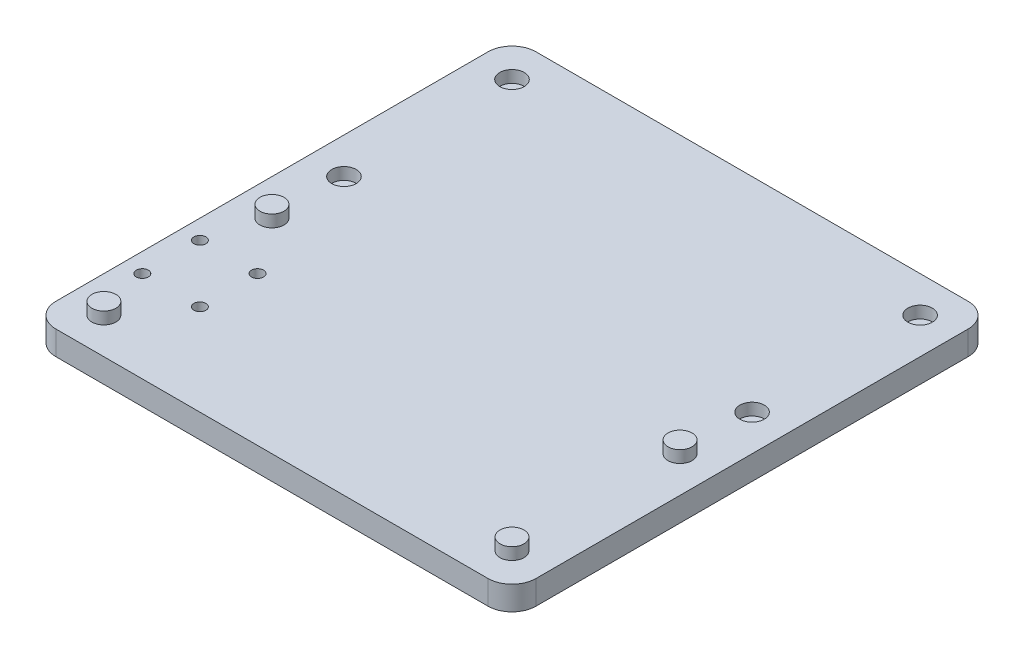
from build123d import *

# Parameters (mm, degrees)
SKETCH_1_W          = 200
SKETCH_1_H          = 200
EXTRUDE_1_DEPTH     = 10
SKETCH_2_R          = 5
EXTRUDE_2_DEPTH     = 5
FILLET_1_R          = 10
SKETCH_3_R          = 5.1
CUT_EXTRUDE_1_DEPTH = 5
SKETCH_4_R          = 2.5
CUT_EXTRUDE_2_DEPTH = 142.774468788


with BuildPart() as part:
    # ｽｹｯﾁ1 → ﾎﾞｽ - 押し出し1 (new body)
    with BuildSketch(Plane(origin=(0, 0, 0), x_dir=(1, 0, 0), z_dir=(0, 1, 0))):
        Rectangle(SKETCH_1_W, SKETCH_1_H)
    extrude(amount=EXTRUDE_1_DEPTH)

    # ｽｹｯﾁ2 → ﾎﾞｽ - 押し出し2 (add)
    with BuildSketch(Plane(origin=(0, 10, 0), x_dir=(1, 0, 0), z_dir=(0, 1, 0))):
        with Locations((-85, -15)):
            Circle(SKETCH_2_R)
        with Locations((-85, -85)):
            Circle(SKETCH_2_R)
        with Locations((85, -85)):
            Circle(SKETCH_2_R)
        with Locations((85, -15)):
            Circle(SKETCH_2_R)
    extrude(amount=EXTRUDE_2_DEPTH)

    # ﾌｨﾚｯﾄ1
    fillet_1_edges = [part.edges().sort_by_distance(p)[0] for p in [
        (100, 5, -100),
        (100, 5, 100),
        (-100, 5, 100),
        (-100, 5, -100),
    ]]
    fillet(fillet_1_edges, radius=FILLET_1_R)

    # ｽｹｯﾁ3 → ｶｯﾄ - 押し出し1 (cut)
    with BuildSketch(Plane(origin=(0, 10, 0), x_dir=(1, 0, 0), z_dir=(0, 1, 0))):
        with Locations((-85, 85)):
            Circle(SKETCH_3_R)
        with Locations((85, 85)):
            Circle(SKETCH_3_R)
        with Locations((-85, 15)):
            Circle(SKETCH_3_R)
        with Locations((85, 15)):
            Circle(SKETCH_3_R)
    extrude(amount=-CUT_EXTRUDE_1_DEPTH, mode=Mode.SUBTRACT)

    # ｽｹｯﾁ4 → ｶｯﾄ - 押し出し2 (cut, through all)
    with BuildSketch(Plane(origin=(0, 10, 0), x_dir=(1, 0, 0), z_dir=(0, 1, 0))):
        with Locations((-68, -38)):
            Circle(SKETCH_4_R)
        with Locations((-68, -62)):
            Circle(SKETCH_4_R)
        with Locations((-92, -62)):
            Circle(SKETCH_4_R)
        with Locations((-92, -38)):
            Circle(SKETCH_4_R)
    extrude(amount=-CUT_EXTRUDE_2_DEPTH, mode=Mode.SUBTRACT)


solid = part.part
